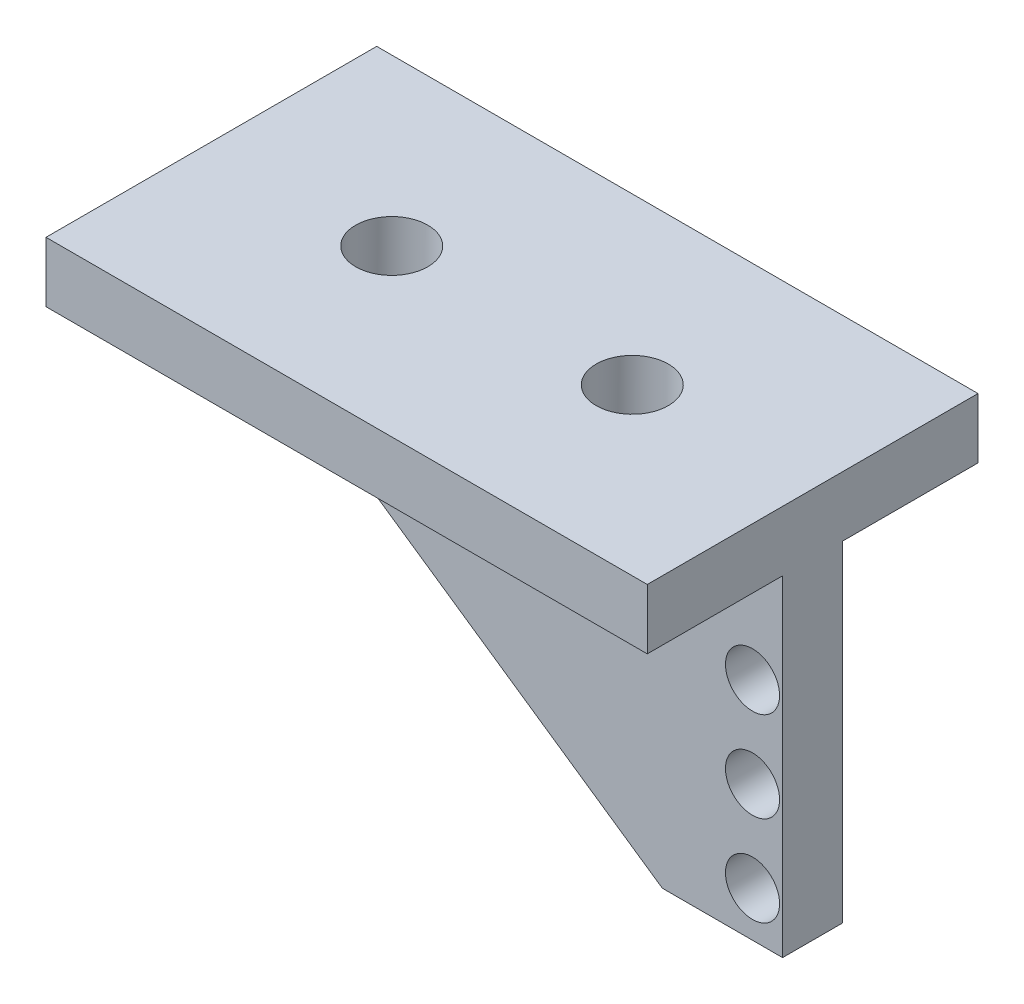
from build123d import *

# Parameters (mm, degrees)
SKETCH1_W           = 20
SKETCH1_H           = 11
BOSS_EXTRUDE1_DEPTH = 2
BOSS_EXTRUDE2_DEPTH = 2
SKETCH3_R           = 0.9
CUT_EXTRUDE1_DEPTH  = 2
SKETCH4_R           = 1.2
CUT_EXTRUDE2_DEPTH  = 2


with BuildPart() as part:
    # Sketch1 → Boss-Extrude1 (new body)
    with BuildSketch(Plane(origin=(0, 0, 0), x_dir=(1, 0, 0), z_dir=(0, 1, 0))):
        with Locations((-10, 0)):
            Rectangle(SKETCH1_W, SKETCH1_H)
    extrude(amount=-BOSS_EXTRUDE1_DEPTH)

    # Sketch2 → Boss-Extrude2 (add)
    with BuildSketch(Plane.XY.offset(-1)):
        Polygon((0, 0), (0, -13), (-4, -13), (-20, -2), (-20, 0), align=None)
    extrude(amount=BOSS_EXTRUDE2_DEPTH)

    # Sketch3 → Cut-Extrude1 (cut)
    with BuildSketch(Plane.XY.offset(-1)):
        with Locations((-1, -5.5)):
            Circle(SKETCH3_R)
        with Locations((-1, -8.5)):
            Circle(SKETCH3_R)
        with Locations((-1, -11.5)):
            Circle(SKETCH3_R)
    extrude(amount=CUT_EXTRUDE1_DEPTH, mode=Mode.SUBTRACT)

    # Sketch4 → Cut-Extrude2 (cut)
    with BuildSketch(Plane(origin=(0, 0, 0), x_dir=(1, 0, 0), z_dir=(0, 1, 0))):
        with Locations((-6, 0)):
            Circle(SKETCH4_R)
        with Locations((-14, 0)):
            Circle(SKETCH4_R)
    extrude(amount=-CUT_EXTRUDE2_DEPTH, mode=Mode.SUBTRACT)


solid = part.part
